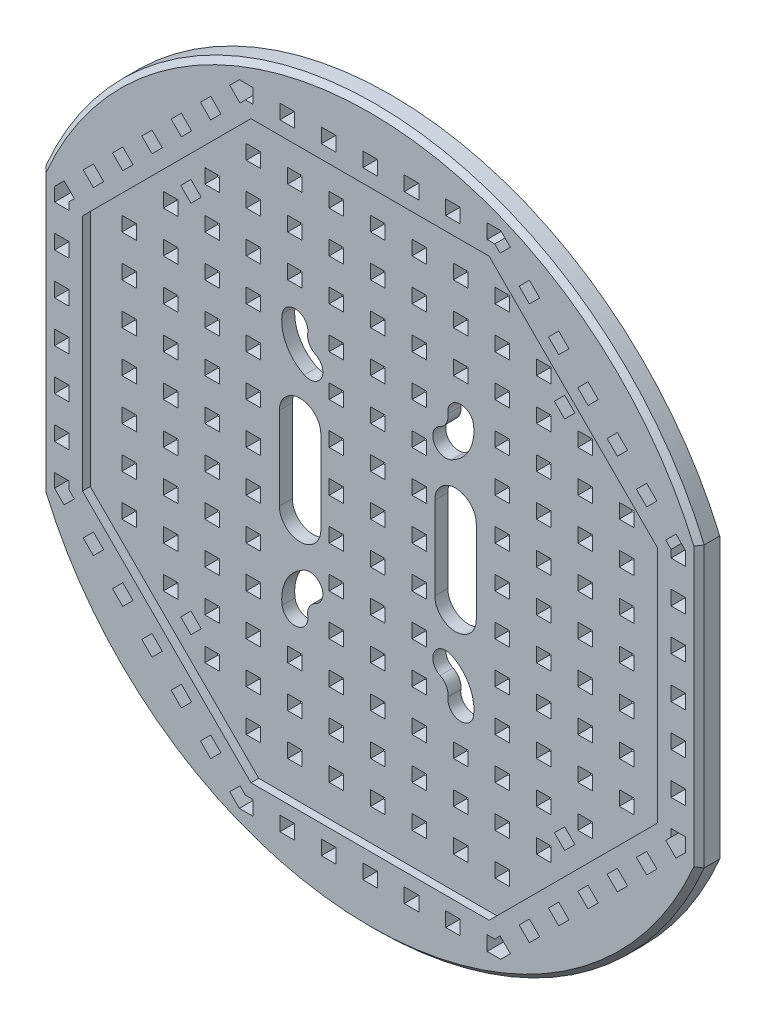
from build123d import *

# Parameters (mm, degrees)
RESSALTO_EXTRUS_O1_DEPTH     = 2.5
CORTE_EXTRUS_O2_DEPTH        = 10.5
RESSALTO_EXTRUS_O2_DEPTH     = 1.5
ESBO_O5_W                    = 2.8
ESBO_O5_H                    = 2.8
CORTE_EXTRUS_O3_DEPTH        = 90.891601387
CORTE_EXTRUS_O4_DEPTH        = 90.891601387
RESSALTO_EXTRUS_O4_START     = -4
RESSALTO_EXTRUS_O4_OUTLINE_R = 69
RESSALTO_EXTRUS_O4_DEPTH     = 4
CHANFRO1_SIZE                = 1
CORTE_EXTRUS_O5_DEPTH        = 98.662684788
CHANFRO2_SIZE                = 1


with BuildPart() as part:
    # Esboço1 → Ressalto-extrusão1 (new body)
    with BuildSketch(Plane.XY):
        Polygon((63.5, -26.302561211), (63.5, 26.302561211), (26.302561211, 63.5), (-26.302561211, 63.5), (-63.5, 26.302561211), (-63.5, -26.302561211), (-26.302561211, -63.5), (26.302561211, -63.5), align=None)
    extrude(amount=RESSALTO_EXTRUS_O1_DEPTH)

    # Esboço4 → Corte-extrusão2 (cut)
    with BuildSketch(Plane.XY.offset(2.5)):
        Polygon((-36.062445841, 34.082546853), (-34.082546853, 36.062445841), (-36.062445841, 38.042344828), (-38.042344828, 36.062445841), align=None)
        Polygon((36.062445841, 34.082546853), (38.042344828, 36.062445841), (36.062445841, 38.042344828), (34.082546853, 36.062445841), align=None)
        Polygon((36.062445841, -38.042344828), (38.042344828, -36.062445841), (36.062445841, -34.082546853), (34.082546853, -36.062445841), align=None)
        Polygon((-36.062445841, -38.042344828), (-34.082546853, -36.062445841), (-36.062445841, -34.082546853), (-38.042344828, -36.062445841), align=None)
    extrude(amount=-CORTE_EXTRUS_O2_DEPTH, mode=Mode.SUBTRACT)

    # Esboço7 → Ressalto-extrusão2 (add)
    with BuildSketch(Plane.XY.offset(2.5)):
        Polygon((26.302561211, -63.5), (63.5, -26.302561211), (63.5, 26.302561211), (26.302561211, 63.5), (-26.302561211, 63.5), (-63.5, 26.302561211), (-63.5, -26.302561211), (-26.302561211, -63.5), align=None)
        Polygon((22.988852712, -55.5), (55.5, -22.988852712), (55.5, 22.988852712), (22.988852712, 55.5), (-22.988852712, 55.5), (-55.5, 22.988852712), (-55.5, -22.988852712), (-22.988852712, -55.5), align=None, mode=Mode.SUBTRACT)
    extrude(amount=RESSALTO_EXTRUS_O2_DEPTH)

    # Esboço5 → Corte-extrusão3 (cut, through all)
    with BuildSketch(Plane(origin=(0, 0, 0), x_dir=(-1, 0, 0), z_dir=(0, 0, -1))):
        Polygon((-47.72970773, -34.436100244), (-49.709606717, -36.415999231), (-47.72970773, -38.395898218), (-45.749808743, -36.415999231), align=None)
        Polygon((-42.072853481, -40.092954493), (-44.052752468, -42.072853481), (-42.072853481, -44.052752468), (-40.092954493, -42.072853481), align=None)
        Polygon((-53.38656198, -28.779245994), (-55.366460967, -30.759144982), (-53.38656198, -32.739043969), (-51.406662992, -30.759144982), align=None)
        with Locations((-8, 24)):
            Rectangle(ESBO_O5_W, ESBO_O5_H)
        Polygon((-25.225605949, -60.9), (-27.082189719, -59.043416229), (-25.102290732, -57.063517242), (-24.065807974, -58.1), (-22.6, -58.1), (-22.6, -60.9), align=None)
        Polygon((-30.759144982, -55.366460967), (-32.739043969, -53.38656198), (-30.759144982, -51.406662992), (-28.779245994, -53.38656198), align=None)
        Polygon((-36.415999231, -49.709606717), (-38.395898218, -47.72970773), (-36.415999231, -45.749808743), (-34.436100244, -47.72970773), align=None)
        with Locations((-8, 8)):
            Rectangle(ESBO_O5_W, ESBO_O5_H)
        with Locations((0, -59.5)):
            Rectangle(ESBO_O5_W, ESBO_O5_H)
        with Locations((-16, -59.5)):
            Rectangle(ESBO_O5_W, ESBO_O5_H)
        with Locations((8, 24)):
            Rectangle(ESBO_O5_W, ESBO_O5_H)
        with Locations((-8, 0)):
            Rectangle(ESBO_O5_W, ESBO_O5_H)
        with Locations((-24, 8)):
            Rectangle(ESBO_O5_W, ESBO_O5_H)
        with Locations((8, -24)):
            Rectangle(ESBO_O5_W, ESBO_O5_H)
        with Locations((-8, -24)):
            Rectangle(ESBO_O5_W, ESBO_O5_H)
        with Locations((-8, -8)):
            Rectangle(ESBO_O5_W, ESBO_O5_H)
        Polygon((24.065807974, -58.1), (25.102290732, -57.063517242), (27.082189719, -59.043416229), (25.225605949, -60.9), (22.6, -60.9), (22.6, -58.1), align=None)
        Polygon((60.9, -25.225605949), (59.043416229, -27.082189719), (57.063517242, -25.102290732), (58.1, -24.065807974), (58.1, -22.6), (60.9, -22.6), align=None)
        with Locations((59.5, -8)):
            Rectangle(ESBO_O5_W, ESBO_O5_H)
        with Locations((59.5, 0)):
            Rectangle(ESBO_O5_W, ESBO_O5_H)
        with Locations((16, -59.5)):
            Rectangle(ESBO_O5_W, ESBO_O5_H)
        with Locations((8, -8)):
            Rectangle(ESBO_O5_W, ESBO_O5_H)
        Polygon((34.436100244, -47.72970773), (36.415999231, -49.709606717), (38.395898218, -47.72970773), (36.415999231, -45.749808743), align=None)
        Polygon((40.092954493, -42.072853481), (42.072853481, -44.052752468), (44.052752468, -42.072853481), (42.072853481, -40.092954493), align=None)
        Polygon((28.779245994, -53.38656198), (30.759144982, -55.366460967), (32.739043969, -53.38656198), (30.759144982, -51.406662992), align=None)
        Polygon((55.366460967, -30.759144982), (53.38656198, -32.739043969), (51.406662992, -30.759144982), (53.38656198, -28.779245994), align=None)
        Polygon((49.709606717, -36.415999231), (47.72970773, -38.395898218), (45.749808743, -36.415999231), (47.72970773, -34.436100244), align=None)
        with Locations((59.5, -16)):
            Rectangle(ESBO_O5_W, ESBO_O5_H)
        with Locations((8, 0)):
            Rectangle(ESBO_O5_W, ESBO_O5_H)
        Polygon((58.1, 24.065807974), (57.063517242, 25.102290732), (59.043416229, 27.082189719), (60.9, 25.225605949), (60.9, 22.6), (58.1, 22.6), align=None)
        Polygon((47.72970773, 34.436100244), (49.709606717, 36.415999231), (47.72970773, 38.395898218), (45.749808743, 36.415999231), align=None)
        Polygon((42.072853481, 40.092954493), (44.052752468, 42.072853481), (42.072853481, 44.052752468), (40.092954493, 42.072853481), align=None)
        Polygon((53.38656198, 28.779245994), (55.366460967, 30.759144982), (53.38656198, 32.739043969), (51.406662992, 30.759144982), align=None)
        with Locations((59.5, 16)):
            Rectangle(ESBO_O5_W, ESBO_O5_H)
        Polygon((25.225605949, 60.9), (27.082189719, 59.043416229), (25.102290732, 57.063517242), (24.065807974, 58.1), (22.6, 58.1), (22.6, 60.9), align=None)
        Polygon((30.759144982, 55.366460967), (32.739043969, 53.38656198), (30.759144982, 51.406662992), (28.779245994, 53.38656198), align=None)
        Polygon((36.415999231, 49.709606717), (38.395898218, 47.72970773), (36.415999231, 45.749808743), (34.436100244, 47.72970773), align=None)
        with Locations((8, 8)):
            Rectangle(ESBO_O5_W, ESBO_O5_H)
        with Locations((16, 59.5)):
            Rectangle(ESBO_O5_W, ESBO_O5_H)
        with Locations((59.5, 8)):
            Rectangle(ESBO_O5_W, ESBO_O5_H)
        Polygon((-24.065807974, 58.1), (-25.102290732, 57.063517242), (-27.082189719, 59.043416229), (-25.225605949, 60.9), (-22.6, 60.9), (-22.6, 58.1), align=None)
        with Locations((-16, 59.5)):
            Rectangle(ESBO_O5_W, ESBO_O5_H)
        with Locations((-8, 59.5)):
            Rectangle(ESBO_O5_W, ESBO_O5_H)
        with Locations((0, 59.5)):
            Rectangle(ESBO_O5_W, ESBO_O5_H)
        Polygon((-34.436100244, 47.72970773), (-36.415999231, 49.709606717), (-38.395898218, 47.72970773), (-36.415999231, 45.749808743), align=None)
        Polygon((-40.092954493, 42.072853481), (-42.072853481, 44.052752468), (-44.052752468, 42.072853481), (-42.072853481, 40.092954493), align=None)
        Polygon((-28.779245994, 53.38656198), (-30.759144982, 55.366460967), (-32.739043969, 53.38656198), (-30.759144982, 51.406662992), align=None)
        Polygon((-55.366460967, 30.759144982), (-53.38656198, 32.739043969), (-51.406662992, 30.759144982), (-53.38656198, 28.779245994), align=None)
        Polygon((-49.709606717, 36.415999231), (-47.72970773, 38.395898218), (-45.749808743, 36.415999231), (-47.72970773, 34.436100244), align=None)
        Rectangle(ESBO_O5_W, ESBO_O5_H)
        with Locations((8, 59.5)):
            Rectangle(ESBO_O5_W, ESBO_O5_H)
        with Locations((8, -59.5)):
            Rectangle(ESBO_O5_W, ESBO_O5_H)
        with Locations((24, 0)):
            Rectangle(ESBO_O5_W, ESBO_O5_H)
        with Locations((-8, -59.5)):
            Rectangle(ESBO_O5_W, ESBO_O5_H)
        with Locations((-48, 8)):
            Rectangle(ESBO_O5_W, ESBO_O5_H)
        with Locations((8, 16)):
            Rectangle(ESBO_O5_W, ESBO_O5_H)
        with Locations((24, 16)):
            Rectangle(ESBO_O5_W, ESBO_O5_H)
        with Locations((16, 24)):
            Rectangle(ESBO_O5_W, ESBO_O5_H)
        with Locations((24, 24)):
            Rectangle(ESBO_O5_W, ESBO_O5_H)
        with Locations((8, 32)):
            Rectangle(ESBO_O5_W, ESBO_O5_H)
        with Locations((16, 32)):
            Rectangle(ESBO_O5_W, ESBO_O5_H)
        with Locations((24, 32)):
            Rectangle(ESBO_O5_W, ESBO_O5_H)
        with Locations((32, 32)):
            Rectangle(ESBO_O5_W, ESBO_O5_H)
        with Locations((40, 32)):
            Rectangle(ESBO_O5_W, ESBO_O5_H)
        with Locations((-40, 8)):
            Rectangle(ESBO_O5_W, ESBO_O5_H)
        with Locations((8, 40)):
            Rectangle(ESBO_O5_W, ESBO_O5_H)
        with Locations((16, 40)):
            Rectangle(ESBO_O5_W, ESBO_O5_H)
        with Locations((24, 40)):
            Rectangle(ESBO_O5_W, ESBO_O5_H)
        with Locations((32, 40)):
            Rectangle(ESBO_O5_W, ESBO_O5_H)
        with Locations((8, 48)):
            Rectangle(ESBO_O5_W, ESBO_O5_H)
        with Locations((16, 48)):
            Rectangle(ESBO_O5_W, ESBO_O5_H)
        with Locations((24, 48)):
            Rectangle(ESBO_O5_W, ESBO_O5_H)
        with Locations((32, 0)):
            Rectangle(ESBO_O5_W, ESBO_O5_H)
        with Locations((32, 16)):
            Rectangle(ESBO_O5_W, ESBO_O5_H)
        with Locations((0, 8)):
            Rectangle(ESBO_O5_W, ESBO_O5_H)
        with Locations((0, 16)):
            Rectangle(ESBO_O5_W, ESBO_O5_H)
        with Locations((0, 24)):
            Rectangle(ESBO_O5_W, ESBO_O5_H)
        with Locations((0, 32)):
            Rectangle(ESBO_O5_W, ESBO_O5_H)
        with Locations((0, 40)):
            Rectangle(ESBO_O5_W, ESBO_O5_H)
        with Locations((0, 48)):
            Rectangle(ESBO_O5_W, ESBO_O5_H)
        with Locations((32, 24)):
            Rectangle(ESBO_O5_W, ESBO_O5_H)
        with Locations((-24, 48)):
            Rectangle(ESBO_O5_W, ESBO_O5_H)
        with Locations((-16, 48)):
            Rectangle(ESBO_O5_W, ESBO_O5_H)
        with Locations((-8, 48)):
            Rectangle(ESBO_O5_W, ESBO_O5_H)
        with Locations((-32, 40)):
            Rectangle(ESBO_O5_W, ESBO_O5_H)
        with Locations((-24, 40)):
            Rectangle(ESBO_O5_W, ESBO_O5_H)
        with Locations((-16, 40)):
            Rectangle(ESBO_O5_W, ESBO_O5_H)
        with Locations((-8, 40)):
            Rectangle(ESBO_O5_W, ESBO_O5_H)
        with Locations((-32, 8)):
            Rectangle(ESBO_O5_W, ESBO_O5_H)
        with Locations((40, 0)):
            Rectangle(ESBO_O5_W, ESBO_O5_H)
        with Locations((-40, 32)):
            Rectangle(ESBO_O5_W, ESBO_O5_H)
        with Locations((-32, 32)):
            Rectangle(ESBO_O5_W, ESBO_O5_H)
        with Locations((-24, 32)):
            Rectangle(ESBO_O5_W, ESBO_O5_H)
        with Locations((-16, 32)):
            Rectangle(ESBO_O5_W, ESBO_O5_H)
        with Locations((-8, 32)):
            Rectangle(ESBO_O5_W, ESBO_O5_H)
        with Locations((-24, 24)):
            Rectangle(ESBO_O5_W, ESBO_O5_H)
        with Locations((-16, 24)):
            Rectangle(ESBO_O5_W, ESBO_O5_H)
        with Locations((-24, 16)):
            Rectangle(ESBO_O5_W, ESBO_O5_H)
        with Locations((-8, 16)):
            Rectangle(ESBO_O5_W, ESBO_O5_H)
        with Locations((40, 16)):
            Rectangle(ESBO_O5_W, ESBO_O5_H)
        with Locations((40, 24)):
            Rectangle(ESBO_O5_W, ESBO_O5_H)
        with Locations((48, 0)):
            Rectangle(ESBO_O5_W, ESBO_O5_H)
        with Locations((40, -32)):
            Rectangle(ESBO_O5_W, ESBO_O5_H)
        with Locations((48, 16)):
            Rectangle(ESBO_O5_W, ESBO_O5_H)
        with Locations((-40, -32)):
            Rectangle(ESBO_O5_W, ESBO_O5_H)
        with Locations((48, 24)):
            Rectangle(ESBO_O5_W, ESBO_O5_H)
        with Locations((-48, 0)):
            Rectangle(ESBO_O5_W, ESBO_O5_H)
        with Locations((-8, -16)):
            Rectangle(ESBO_O5_W, ESBO_O5_H)
        with Locations((-24, -16)):
            Rectangle(ESBO_O5_W, ESBO_O5_H)
        with Locations((-16, -24)):
            Rectangle(ESBO_O5_W, ESBO_O5_H)
        with Locations((-24, -24)):
            Rectangle(ESBO_O5_W, ESBO_O5_H)
        with Locations((-8, -32)):
            Rectangle(ESBO_O5_W, ESBO_O5_H)
        with Locations((-16, -32)):
            Rectangle(ESBO_O5_W, ESBO_O5_H)
        with Locations((-24, -32)):
            Rectangle(ESBO_O5_W, ESBO_O5_H)
        with Locations((-32, -32)):
            Rectangle(ESBO_O5_W, ESBO_O5_H)
        with Locations((-8, -40)):
            Rectangle(ESBO_O5_W, ESBO_O5_H)
        with Locations((-16, -40)):
            Rectangle(ESBO_O5_W, ESBO_O5_H)
        with Locations((-24, -40)):
            Rectangle(ESBO_O5_W, ESBO_O5_H)
        with Locations((-32, -40)):
            Rectangle(ESBO_O5_W, ESBO_O5_H)
        with Locations((-8, -48)):
            Rectangle(ESBO_O5_W, ESBO_O5_H)
        with Locations((-16, -48)):
            Rectangle(ESBO_O5_W, ESBO_O5_H)
        with Locations((-24, -48)):
            Rectangle(ESBO_O5_W, ESBO_O5_H)
        with Locations((-40, 0)):
            Rectangle(ESBO_O5_W, ESBO_O5_H)
        with Locations((0, -48)):
            Rectangle(ESBO_O5_W, ESBO_O5_H)
        with Locations((0, -40)):
            Rectangle(ESBO_O5_W, ESBO_O5_H)
        with Locations((0, -32)):
            Rectangle(ESBO_O5_W, ESBO_O5_H)
        with Locations((0, -24)):
            Rectangle(ESBO_O5_W, ESBO_O5_H)
        with Locations((0, -16)):
            Rectangle(ESBO_O5_W, ESBO_O5_H)
        with Locations((0, -8)):
            Rectangle(ESBO_O5_W, ESBO_O5_H)
        with Locations((-32, 0)):
            Rectangle(ESBO_O5_W, ESBO_O5_H)
        with Locations((24, -48)):
            Rectangle(ESBO_O5_W, ESBO_O5_H)
        with Locations((16, -48)):
            Rectangle(ESBO_O5_W, ESBO_O5_H)
        with Locations((8, -48)):
            Rectangle(ESBO_O5_W, ESBO_O5_H)
        with Locations((32, -40)):
            Rectangle(ESBO_O5_W, ESBO_O5_H)
        with Locations((24, -40)):
            Rectangle(ESBO_O5_W, ESBO_O5_H)
        with Locations((16, -40)):
            Rectangle(ESBO_O5_W, ESBO_O5_H)
        with Locations((8, -40)):
            Rectangle(ESBO_O5_W, ESBO_O5_H)
        with Locations((32, -32)):
            Rectangle(ESBO_O5_W, ESBO_O5_H)
        with Locations((24, -32)):
            Rectangle(ESBO_O5_W, ESBO_O5_H)
        with Locations((16, -32)):
            Rectangle(ESBO_O5_W, ESBO_O5_H)
        with Locations((8, -32)):
            Rectangle(ESBO_O5_W, ESBO_O5_H)
        with Locations((24, -24)):
            Rectangle(ESBO_O5_W, ESBO_O5_H)
        with Locations((16, -24)):
            Rectangle(ESBO_O5_W, ESBO_O5_H)
        with Locations((24, -16)):
            Rectangle(ESBO_O5_W, ESBO_O5_H)
        with Locations((8, -16)):
            Rectangle(ESBO_O5_W, ESBO_O5_H)
        with Locations((-24, 0)):
            Rectangle(ESBO_O5_W, ESBO_O5_H)
        with Locations((-48, 24)):
            Rectangle(ESBO_O5_W, ESBO_O5_H)
        Polygon((-60.9, 25.225605949), (-59.043416229, 27.082189719), (-57.063517242, 25.102290732), (-58.1, 24.065807974), (-58.1, 22.6), (-60.9, 22.6), align=None)
        with Locations((-59.5, 8)):
            Rectangle(ESBO_O5_W, ESBO_O5_H)
        with Locations((-59.5, 16)):
            Rectangle(ESBO_O5_W, ESBO_O5_H)
        Polygon((-58.1, -24.065807974), (-57.063517242, -25.102290732), (-59.043416229, -27.082189719), (-60.9, -25.225605949), (-60.9, -22.6), (-58.1, -22.6), align=None)
        with Locations((-59.5, -16)):
            Rectangle(ESBO_O5_W, ESBO_O5_H)
        with Locations((-59.5, -8)):
            Rectangle(ESBO_O5_W, ESBO_O5_H)
        with Locations((-59.5, 0)):
            Rectangle(ESBO_O5_W, ESBO_O5_H)
        with Locations((-40, 24)):
            Rectangle(ESBO_O5_W, ESBO_O5_H)
        with Locations((-32, 24)):
            Rectangle(ESBO_O5_W, ESBO_O5_H)
        with Locations((-48, 16)):
            Rectangle(ESBO_O5_W, ESBO_O5_H)
        with Locations((-40, 16)):
            Rectangle(ESBO_O5_W, ESBO_O5_H)
        with Locations((-32, 16)):
            Rectangle(ESBO_O5_W, ESBO_O5_H)
        with Locations((32, 8)):
            Rectangle(ESBO_O5_W, ESBO_O5_H)
        with Locations((40, 8)):
            Rectangle(ESBO_O5_W, ESBO_O5_H)
        with Locations((48, 8)):
            Rectangle(ESBO_O5_W, ESBO_O5_H)
        with Locations((24, 8)):
            Rectangle(ESBO_O5_W, ESBO_O5_H)
        with Locations((24, -8)):
            Rectangle(ESBO_O5_W, ESBO_O5_H)
        with Locations((48, -8)):
            Rectangle(ESBO_O5_W, ESBO_O5_H)
        with Locations((40, -8)):
            Rectangle(ESBO_O5_W, ESBO_O5_H)
        with Locations((32, -8)):
            Rectangle(ESBO_O5_W, ESBO_O5_H)
        with Locations((-32, -16)):
            Rectangle(ESBO_O5_W, ESBO_O5_H)
        with Locations((-40, -16)):
            Rectangle(ESBO_O5_W, ESBO_O5_H)
        with Locations((-48, -16)):
            Rectangle(ESBO_O5_W, ESBO_O5_H)
        with Locations((-32, -24)):
            Rectangle(ESBO_O5_W, ESBO_O5_H)
        with Locations((-40, -24)):
            Rectangle(ESBO_O5_W, ESBO_O5_H)
        with Locations((-48, -24)):
            Rectangle(ESBO_O5_W, ESBO_O5_H)
        with Locations((-32, -8)):
            Rectangle(ESBO_O5_W, ESBO_O5_H)
        with Locations((-40, -8)):
            Rectangle(ESBO_O5_W, ESBO_O5_H)
        with Locations((-48, -8)):
            Rectangle(ESBO_O5_W, ESBO_O5_H)
        with Locations((-24, -8)):
            Rectangle(ESBO_O5_W, ESBO_O5_H)
        with Locations((48, -24)):
            Rectangle(ESBO_O5_W, ESBO_O5_H)
        with Locations((48, -16)):
            Rectangle(ESBO_O5_W, ESBO_O5_H)
        with Locations((40, -24)):
            Rectangle(ESBO_O5_W, ESBO_O5_H)
        with Locations((40, -16)):
            Rectangle(ESBO_O5_W, ESBO_O5_H)
        with Locations((32, -24)):
            Rectangle(ESBO_O5_W, ESBO_O5_H)
        with Locations((32, -16)):
            Rectangle(ESBO_O5_W, ESBO_O5_H)
    extrude(amount=-CORTE_EXTRUS_O3_DEPTH, mode=Mode.SUBTRACT)

    # Esboço6 → Corte-extrusão4 (cut, through all)
    with BuildSketch(Plane(origin=(0, 0, 0), x_dir=(-1, 0, 0), z_dir=(0, 0, -1))):
        with BuildLine():
            Line((-11, 8), (-11, -8))
            ThreePointArc((-11, -8), (-15, -12), (-19, -8))
            Line((-19, -8), (-19, 8))
            ThreePointArc((-19, 8), (-15, 12), (-11, 8))
        make_face()
        with BuildLine():
            Line((11, 8), (11, -8))
            ThreePointArc((11, -8), (15, -12), (19, -8))
            Line((19, -8), (19, 8))
            ThreePointArc((19, 8), (15, 12), (11, 8))
        make_face()
        with BuildLine():
            ThreePointArc((14.200297969, 16.315145811), (17.649253561, 19.637251237), (18.474772288, 24.354262787))
            ThreePointArc((18.474772288, 24.354262787), (15.645737213, 26.474772288), (13.525227712, 23.645737213))
            ThreePointArc((13.525227712, 23.645737213), (13.234515597, 21.984609051), (12.01994209, 20.814706705))
            ThreePointArc((12.01994209, 20.814706705), (10.860339583, 17.474748318), (14.200297969, 16.315145811))
        make_face()
        with BuildLine():
            ThreePointArc((-14.200297969, 16.315145811), (-17.649253561, 19.637251237), (-18.474772288, 24.354262787))
            ThreePointArc((-18.474772288, 24.354262787), (-15.645737213, 26.474772288), (-13.525227712, 23.645737213))
            ThreePointArc((-13.525227712, 23.645737213), (-13.234515597, 21.984609051), (-12.01994209, 20.814706705))
            ThreePointArc((-12.01994209, 20.814706705), (-10.860339583, 17.474748318), (-14.200297969, 16.315145811))
        make_face()
        with BuildLine():
            ThreePointArc((-14.200297969, -16.315145811), (-17.649253561, -19.637251237), (-18.474772288, -24.354262787))
            ThreePointArc((-18.474772288, -24.354262787), (-15.645737213, -26.474772288), (-13.525227712, -23.645737213))
            ThreePointArc((-13.525227712, -23.645737213), (-13.234515597, -21.984609051), (-12.01994209, -20.814706705))
            ThreePointArc((-12.01994209, -20.814706705), (-10.860339583, -17.474748318), (-14.200297969, -16.315145811))
        make_face()
        with BuildLine():
            ThreePointArc((14.200297969, -16.315145811), (17.649253561, -19.637251237), (18.474772288, -24.354262787))
            ThreePointArc((18.474772288, -24.354262787), (15.645737213, -26.474772288), (13.525227712, -23.645737213))
            ThreePointArc((13.525227712, -23.645737213), (13.234515597, -21.984609051), (12.01994209, -20.814706705))
            ThreePointArc((12.01994209, -20.814706705), (10.860339583, -17.474748318), (14.200297969, -16.315145811))
        make_face()
    extrude(amount=-CORTE_EXTRUS_O4_DEPTH, mode=Mode.SUBTRACT)

    # Ressalto-extrusão4: read off the stored shape, not the designer's step
    # Ressalto-extrusão4 outline → Ressalto-extrusão4 (add)
    with BuildSketch(Plane(origin=(0, 0, 0), x_dir=(-1, 0, 0), z_dir=(0, 0, -1)).offset(RESSALTO_EXTRUS_O4_START)):
        Circle(RESSALTO_EXTRUS_O4_OUTLINE_R)
        Polygon((26.302561211, -63.5), (-26.302561211, -63.5), (-63.5, -26.302561211), (-63.5, 26.302561211), (-26.302561211, 63.5), (26.302561211, 63.5), (63.5, 26.302561211), (63.5, -26.302561211), align=None, mode=Mode.SUBTRACT)
    extrude(amount=RESSALTO_EXTRUS_O4_DEPTH)

    # Chanfro1
    chanfro1_edges = [part.edges().sort_by_distance(p)[0] for p in [
        (69, 0, 4),
    ]]
    chamfer(chanfro1_edges, length=CHANFRO1_SIZE)

    # Esboço9 → Corte-extrusão5 (cut, through all)
    with BuildSketch(Plane(origin=(0, 0, 0), x_dir=(-1, 0, 0), z_dir=(0, 0, -1))):
        with BuildLine():
            Line((63.5, -63.778915011), (63.5, 63.778915011))
            ThreePointArc((63.5, 63.778915011), (90, 0), (63.5, -63.778915011))
        make_face()
        with BuildLine():
            Line((-63.5, 63.778915011), (-63.5, -63.778915011))
            ThreePointArc((-63.5, -63.778915011), (-90, 0), (-63.5, 63.778915011))
        make_face()
    extrude(amount=-CORTE_EXTRUS_O5_DEPTH, mode=Mode.SUBTRACT)

    # Chanfro2
    chanfro2_edges = [part.edges().sort_by_distance(p)[0] for p in [
        (-63.5, 0, 4),
        (63.5, 0, 4),
    ]]
    chamfer(chanfro2_edges, length=CHANFRO2_SIZE)


solid = part.part
